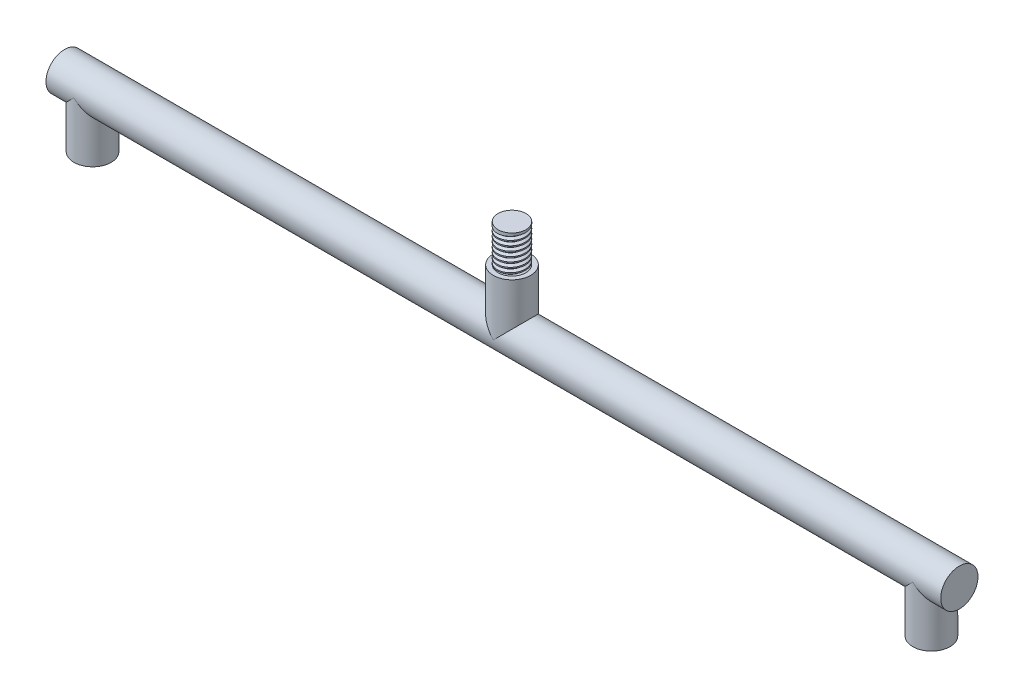
from build123d import *
from build123d.topology import SkipClean

# Parameters (mm, degrees)
SKETCH5_R           = 1
BOSS_EXTRUDE1_DEPTH = 24
SKETCH6_R           = 1
BOSS_EXTRUDE2_DEPTH = 5
SKETCH7_OUTSIDE_W   = 59.682
SKETCH7_OUTSIDE_H   = 13.682
SKETCH7_OUTSIDE_R   = 0.75
CUT_EXTRUDE1_DEPTH  = 2
THREAD1_PITCH       = 0.25
CUT_EXTRUDE2_DEPTH  = 2
SKETCH11_R          = 1
BOSS_EXTRUDE3_DEPTH = 3
SKETCH12_R          = 0.75
CUT_EXTRUDE3_DEPTH  = 1.5
THREAD2_PITCH       = 0.25
THREAD3_PITCH       = 0.25


with BuildPart() as part:
    # Sketch5 → Boss-Extrude1 (new, symmetric)
    with BuildSketch(Plane(origin=(0, 0, 0), x_dir=(0, 0, -1), z_dir=(1, 0, 0))):
        Circle(SKETCH5_R)
    extrude(amount=BOSS_EXTRUDE1_DEPTH, both=True)

    # Sketch6 → Boss-Extrude2 (add)
    with BuildSketch(Plane(origin=(0, 0, 0), x_dir=(1, 0, 0), z_dir=(0, 1, 0))):
        with Locations(Location((0, 0, 0), (0, 0, 270))):
            Circle(SKETCH6_R)
    extrude(amount=BOSS_EXTRUDE2_DEPTH)

    # Sketch7 outside → Cut-Extrude1 (cut)
    with BuildSketch(Plane(origin=(0, 5, 0), x_dir=(1, 0, 0), z_dir=(0, 1, 0))):
        Rectangle(SKETCH7_OUTSIDE_W, SKETCH7_OUTSIDE_H)
        with Locations(Location((0, 0, 0), (0, 0, 270))):
            Circle(SKETCH7_OUTSIDE_R, mode=Mode.SUBTRACT)
    extrude(amount=-CUT_EXTRUDE1_DEPTH, mode=Mode.SUBTRACT)

    # Thread1: the profile of Thread Profile1 profile screwed along a right-hand helix of 8 turns, 6 arcs to a turn; built about Z, then put on its axis
    thread1_z = Axis((0, 0, 0), (0, 0, 1))
    thread1_corners = [(0.7503, 0, -0.000173205), (0.614683531, 0, 0.078125), (0.614683531, 0, 0.109375), (0.7503, 0, 0.187673204)]
    with BuildLine(mode=Mode.PRIVATE) as thread1_profile:
        Line(thread1_corners[0], thread1_corners[1])
        Line(thread1_corners[1], thread1_corners[2])
        Line(thread1_corners[2], thread1_corners[3])
        Line(thread1_corners[3], thread1_corners[0])
    thread1_cap = Face(thread1_profile.wire())
    thread1_turn_angles = [0, 30, 60, 90, 120, 150, 180, 210, 240, 270, 300, 330, 360]
    thread1_turn_weights = [1, 0.8660254037844387, 1, 0.8660254037844387, 1, 0.8660254037844387, 1, 0.8660254037844387, 1, 0.8660254037844387, 1, 0.8660254037844387, 1]
    thread1_turn_rails = [Edge.make_bspline([Vector(p[0], p[1], 0).rotate(thread1_z, thread1_turn_angles[k]) / thread1_turn_weights[k] + Vector(0, 0, p[2] + THREAD1_PITCH * thread1_turn_angles[k] / 360) for k in range(13)], [0, 0, 0, 1, 1, 2, 2, 3, 3, 4, 4, 5, 5, 6, 6, 6], 2, thread1_turn_weights) for p in thread1_corners]
    thread1_turn_sides = [Face.make_surface_from_curves(thread1_turn_rails[p[0]], thread1_turn_rails[p[1]]) for p in [(0, 1), (1, 2), (2, 3), (3, 0)]]
    thread1 = Plane(origin=(0, 5, 0), x_dir=(-1, 0, 0), z_dir=(0, -1, 0)) * Solid(Shell([*[p.moved(Location((0, 0, THREAD1_PITCH * i))) for i in range(8) for p in thread1_turn_sides], thread1_cap, thread1_cap.rotate(thread1_z, 2880).moved(Location((0, 0, THREAD1_PITCH * 2880 / 360)))]))
    add(thread1, mode=Mode.SUBTRACT)

    # Sketch10 → Cut-Extrude2 (cut)
    with BuildSketch(Plane(origin=(0, 0, 0), x_dir=(-1, 0, 0), z_dir=(0, 0, -1))):
        Polygon((0.614683531, 4.921875), (0.614683531, 4.890625), (0.75, 4.812500001), (0.75, 5), align=None)
    extrude(amount=-CUT_EXTRUDE2_DEPTH, mode=Mode.SUBTRACT)

    # Sketch11 → Boss-Extrude3 (add)
    with BuildSketch(Plane(origin=(0, 0, 0), x_dir=(1, 0, 0), z_dir=(0, 1, 0))):
        with Locations(Location((-22.5, 0, 0), (0, 0, 270))):
            Circle(SKETCH11_R)
        with Locations(Location((22.5, 0, 0), (0, 0, 270))):
            Circle(SKETCH11_R)
    extrude(amount=-BOSS_EXTRUDE3_DEPTH)

    # Sketch12 → Cut-Extrude3 (cut)
    with BuildSketch(Plane.XZ.offset(3)):
        with Locations(Location((-22.5, 0, 0), (0, 0, 270))):
            Circle(SKETCH12_R)
        with Locations(Location((22.5, 0, 0), (0, 0, 270))):
            Circle(SKETCH12_R)
    extrude(amount=-CUT_EXTRUDE3_DEPTH, mode=Mode.SUBTRACT)

    # Thread2: the profile of Thread Profile2 profile screwed along a right-hand helix of 6 turns, 6 arcs to a turn; built about Z, then put on its axis
    with SkipClean():  # the faces are left unmerged after this step: merging them gives an invalid solid
        thread2_z = Axis((0, 0, 0), (0, 0, 1))
        thread2_corners = [(0.7497, 0, -0.000173205), (0.885316469, 0, 0.078125), (0.885316469, 0, 0.109375), (0.7497, 0, 0.187673204)]
        with BuildLine(mode=Mode.PRIVATE) as thread2_profile:
            Line(thread2_corners[0], thread2_corners[1])
            Line(thread2_corners[1], thread2_corners[2])
            Line(thread2_corners[2], thread2_corners[3])
            Line(thread2_corners[3], thread2_corners[0])
        thread2_cap = Face(thread2_profile.wire())
        thread2_turn_angles = [0, 30, 60, 90, 120, 150, 180, 210, 240, 270, 300, 330, 360]
        thread2_turn_weights = [1, 0.8660254037844387, 1, 0.8660254037844387, 1, 0.8660254037844387, 1, 0.8660254037844387, 1, 0.8660254037844387, 1, 0.8660254037844387, 1]
        thread2_turn_rails = [Edge.make_bspline([Vector(p[0], p[1], 0).rotate(thread2_z, thread2_turn_angles[k]) / thread2_turn_weights[k] + Vector(0, 0, p[2] + THREAD2_PITCH * thread2_turn_angles[k] / 360) for k in range(13)], [0, 0, 0, 1, 1, 2, 2, 3, 3, 4, 4, 5, 5, 6, 6, 6], 2, thread2_turn_weights) for p in thread2_corners]
        thread2_turn_sides = [Face.make_surface_from_curves(thread2_turn_rails[p[0]], thread2_turn_rails[p[1]]) for p in [(0, 1), (1, 2), (2, 3), (3, 0)]]
        thread2 = Plane(origin=(-22.5, -3, 0), x_dir=(1, 0, 0), z_dir=(0, 1, 0)) * Solid(Shell([*[p.moved(Location((0, 0, THREAD2_PITCH * i))) for i in range(6) for p in thread2_turn_sides], thread2_cap, thread2_cap.rotate(thread2_z, 2160).moved(Location((0, 0, THREAD2_PITCH * 2160 / 360)))]))
        add(thread2, mode=Mode.SUBTRACT)

    # Thread3: the profile of Thread Profile3 profile screwed along a right-hand helix of 6 turns, 6 arcs to a turn; built about Z, then put on its axis
    with SkipClean():  # the faces are left unmerged after this step: merging them gives an invalid solid
        thread3_z = Axis((0, 0, 0), (0, 0, 1))
        thread3_corners = [(0.7497, 0, -0.000173205), (0.885316469, 0, 0.078125), (0.885316469, 0, 0.109375), (0.7497, 0, 0.187673204)]
        with BuildLine(mode=Mode.PRIVATE) as thread3_profile:
            Line(thread3_corners[0], thread3_corners[1])
            Line(thread3_corners[1], thread3_corners[2])
            Line(thread3_corners[2], thread3_corners[3])
            Line(thread3_corners[3], thread3_corners[0])
        thread3_cap = Face(thread3_profile.wire())
        thread3_turn_angles = [0, 30, 60, 90, 120, 150, 180, 210, 240, 270, 300, 330, 360]
        thread3_turn_weights = [1, 0.8660254037844387, 1, 0.8660254037844387, 1, 0.8660254037844387, 1, 0.8660254037844387, 1, 0.8660254037844387, 1, 0.8660254037844387, 1]
        thread3_turn_rails = [Edge.make_bspline([Vector(p[0], p[1], 0).rotate(thread3_z, thread3_turn_angles[k]) / thread3_turn_weights[k] + Vector(0, 0, p[2] + THREAD3_PITCH * thread3_turn_angles[k] / 360) for k in range(13)], [0, 0, 0, 1, 1, 2, 2, 3, 3, 4, 4, 5, 5, 6, 6, 6], 2, thread3_turn_weights) for p in thread3_corners]
        thread3_turn_sides = [Face.make_surface_from_curves(thread3_turn_rails[p[0]], thread3_turn_rails[p[1]]) for p in [(0, 1), (1, 2), (2, 3), (3, 0)]]
        thread3 = Plane(origin=(22.5, -3, 0), x_dir=(1, 0, 0), z_dir=(0, 1, 0)) * Solid(Shell([*[p.moved(Location((0, 0, THREAD3_PITCH * i))) for i in range(6) for p in thread3_turn_sides], thread3_cap, thread3_cap.rotate(thread3_z, 2160).moved(Location((0, 0, THREAD3_PITCH * 2160 / 360)))]))
        add(thread3, mode=Mode.SUBTRACT)


solid = part.part
